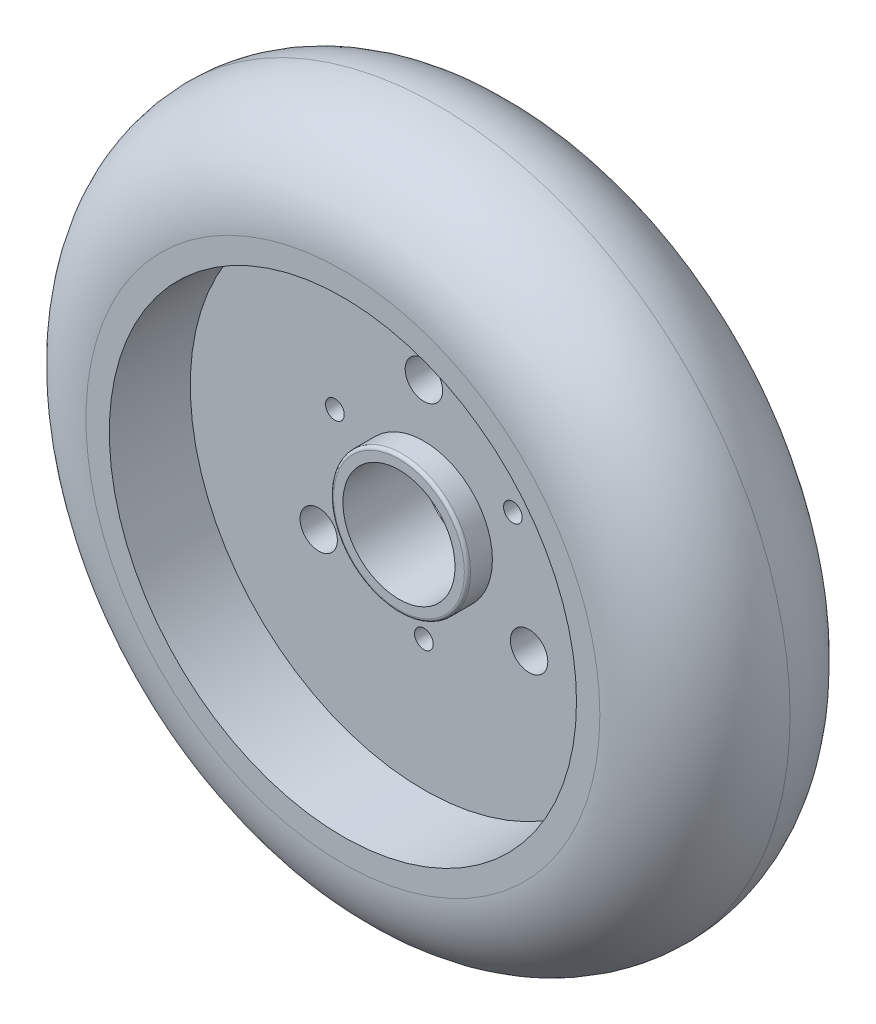
from build123d import *

# Parameters (mm, degrees)
SKETCH1_R           = 28.70835
BOSS_EXTRUDE1_DEPTH = 15.50924
FILLET1_R           = 7.75462
SKETCH2_R           = 19.05
CUT_EXTRUDE2_DEPTH  = 6.604
CUT_EXTRUDE3_START  = -6.604
SKETCH3_R           = 19.05
CUT_EXTRUDE3_DEPTH  = 6.604
SKETCH4_R           = 5.588
SKETCH4_R_2         = 4.572
BOSS_EXTRUDE2_DEPTH = 2.032
CUT_EXTRUDE4_START  = -11.43
SKETCH5_R           = 4.572
CUT_EXTRUDE4_DEPTH  = 11.43
SKETCH6_R           = 1.524
CUT_EXTRUDE5_DEPTH  = 11.43
CIRPATTERN1_COUNT   = 3
SKETCH10_R          = 0.762
CUT_EXTRUDE8_DEPTH  = 11.43
CIRPATTERN3_COUNT   = 3
FILLET2_R           = 0.254
FILLET3_R           = 0.254


with BuildPart() as part:
    # Sketch1 → Boss-Extrude1 (new body)
    with BuildSketch(Plane.XY):
        Circle(SKETCH1_R)
    extrude(amount=BOSS_EXTRUDE1_DEPTH)

    # Fillet1
    fillet1_edges = [part.edges().sort_by_distance(p)[0] for p in [
        (-28.70835, 0, 0),
        (-28.70835, 0, 15.50924),
    ]]
    fillet(fillet1_edges, radius=FILLET1_R - 0.0001)  # a hair under: the kernel refuses the full size

    # Sketch2 → Cut-Extrude2 (cut)
    with BuildSketch(Plane.XY.offset(15.50924)):
        Circle(SKETCH2_R)
    extrude(amount=-CUT_EXTRUDE2_DEPTH, mode=Mode.SUBTRACT)

    # Sketch3 → Cut-Extrude3 (cut)
    with BuildSketch(Plane(origin=(0, 0, 0), x_dir=(-1, 0, 0), z_dir=(0, 0, -1)).offset(CUT_EXTRUDE3_START)):
        with Locations(Location((0, 0, 0), (0, 0, 180))):
            Circle(SKETCH3_R)
    extrude(amount=CUT_EXTRUDE3_DEPTH, mode=Mode.SUBTRACT)

    # Sketch4 → Boss-Extrude2 (add)
    with BuildSketch(Plane.XY.offset(8.90524)):
        Circle(SKETCH4_R)
        Circle(SKETCH4_R_2, mode=Mode.SUBTRACT)
    boss_extrude2 = extrude(amount=BOSS_EXTRUDE2_DEPTH)

    # Sketch5 → Cut-Extrude4 (cut)
    with BuildSketch(Plane.XY.offset(8.90524).offset(CUT_EXTRUDE4_START)):
        with Locations(Location((0, 0, 0), (0, 0, 180))):
            Circle(SKETCH5_R)
    extrude(amount=CUT_EXTRUDE4_DEPTH, mode=Mode.SUBTRACT)

    # Mirror4: Boss-Extrude2 across plane
    add(boss_extrude2.mirror(Plane.XY.offset(7.75462)))

    # Sketch6 → Cut-Extrude5 (cut)
    with BuildSketch(Plane.XY.offset(8.90524)):
        with Locations((0, 9.906)):
            Circle(SKETCH6_R)
    cut_extrude5 = extrude(amount=-CUT_EXTRUDE5_DEPTH, mode=Mode.SUBTRACT)

    # CirPattern1: Cut-Extrude5 ×3 about axis
    cirpattern1_axis = Axis((0, 0, 0), (0, 0, 1))
    for i in range(1, CIRPATTERN1_COUNT):
        add(cut_extrude5.rotate(cirpattern1_axis, i * 360 / CIRPATTERN1_COUNT), mode=Mode.SUBTRACT)

    # Sketch10 → Cut-Extrude8 (cut)
    with BuildSketch(Plane.XY.offset(8.90524)):
        with Locations((0, -8.382)):
            Circle(SKETCH10_R)
    cut_extrude8 = extrude(amount=-CUT_EXTRUDE8_DEPTH, mode=Mode.SUBTRACT)

    # CirPattern3: Cut-Extrude8 ×3 about axis
    cirpattern3_axis = Axis((0, 0, 0), (0, 0, 1))
    for i in range(1, CIRPATTERN3_COUNT):
        add(cut_extrude8.rotate(cirpattern3_axis, i * 360 / CIRPATTERN3_COUNT), mode=Mode.SUBTRACT)

    # Fillet2
    fillet2_edges = [part.edges().sort_by_distance(p)[0] for p in [
        (-5.588, 0, 10.93724),
    ]]
    fillet(fillet2_edges, radius=FILLET2_R)

    # Fillet3
    fillet3_edges = [part.edges().sort_by_distance(p)[0] for p in [
        (-5.588, 0, 4.572),
    ]]
    fillet(fillet3_edges, radius=FILLET3_R)


solid = part.part
